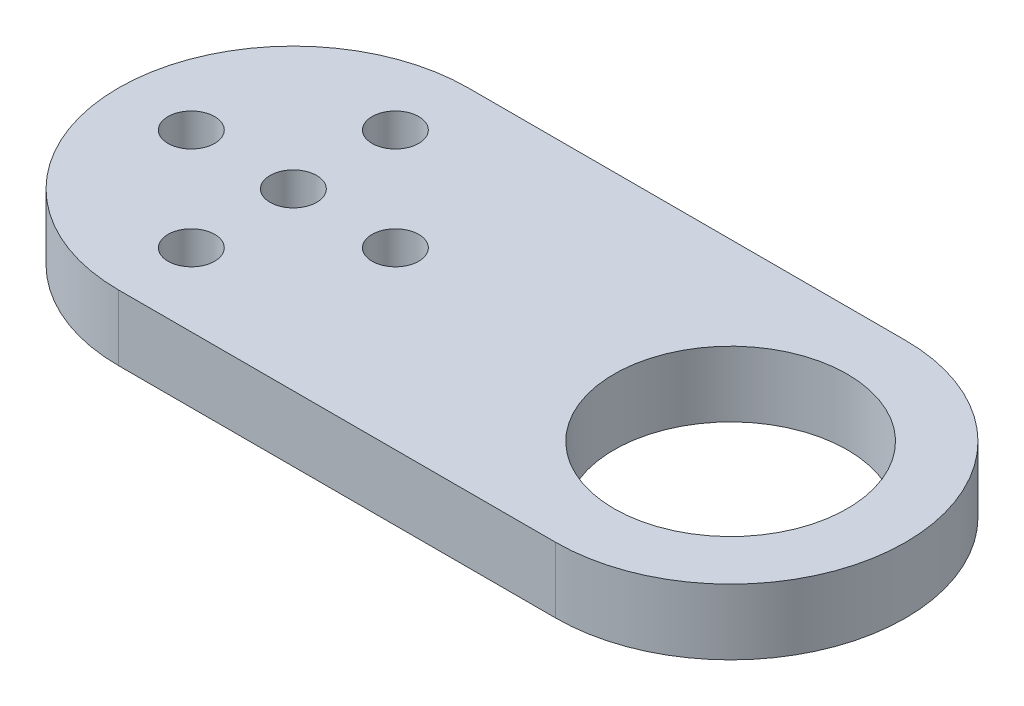
from build123d import *

# Parameters (mm, degrees)
BOSS_EXTRUDE1_DEPTH     = 4.5
SKETCH4_R               = 1.6
SERVO_HORN_HOLES_DEPTH  = 30.887288268
SKETCH5_R               = 8
BEARING_PRESS_FIT_DEPTH = 30.887288268


with BuildPart() as part:
    # Sketch2 → Boss-Extrude1 (new body)
    with BuildSketch(Plane(origin=(0, 0, 0), x_dir=(1, 0, 0), z_dir=(0, 1, 0))):
        with BuildLine():
            Line((15, 12), (-15, 12))
            ThreePointArc((-15, 12), (-27, 0), (-15, -12))
            Line((-15, -12), (15, -12))
            ThreePointArc((15, -12), (27, 0), (15, 12))
        make_face()
    extrude(amount=BOSS_EXTRUDE1_DEPTH)

    # Sketch4 → Servo horn holes (cut, through all)
    with BuildSketch(Plane(origin=(0, 4.5, 0), x_dir=(1, 0, 0), z_dir=(0, 1, 0))):
        with Locations((-15, 0)):
            Circle(SKETCH4_R)
        with Locations((-8, 0)):
            Circle(SKETCH4_R)
        with Locations((-15, -7)):
            Circle(SKETCH4_R)
        with Locations((-22, 0)):
            Circle(SKETCH4_R)
        with Locations((-15, 7)):
            Circle(SKETCH4_R)
    extrude(amount=-SERVO_HORN_HOLES_DEPTH, mode=Mode.SUBTRACT)

    # Sketch5 → Bearing press fit (cut, through all)
    with BuildSketch(Plane(origin=(0, 0, 0), x_dir=(-1, 0, 0), z_dir=(0, -1, 0))):
        with Locations((-15, 0)):
            Circle(SKETCH5_R)
    extrude(amount=-BEARING_PRESS_FIT_DEPTH, mode=Mode.SUBTRACT)


solid = part.part
